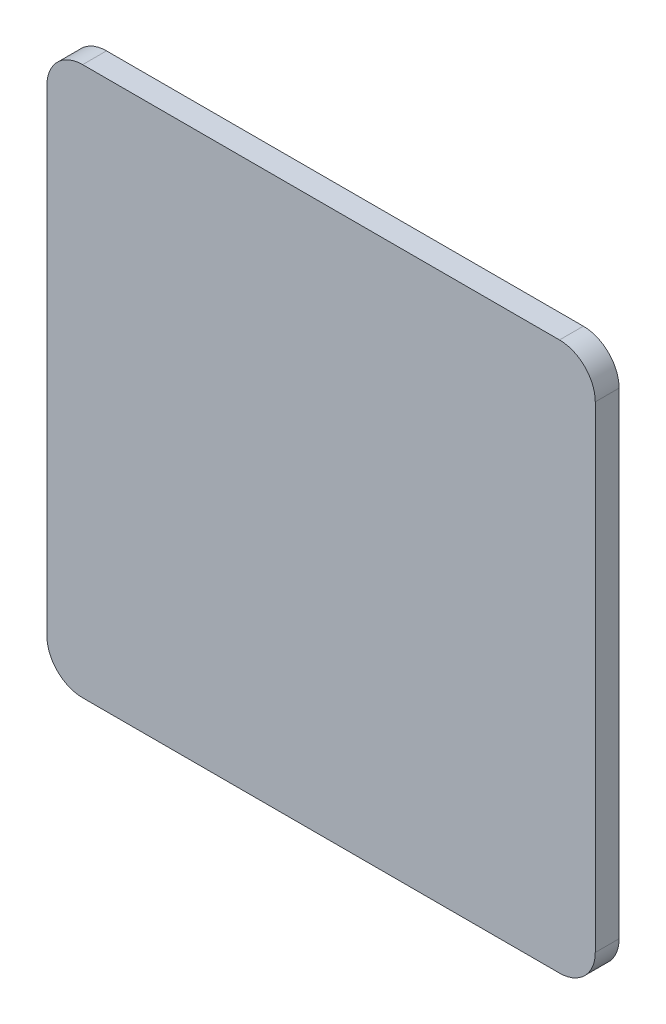
from build123d import *

# Parameters (mm, degrees)
SKETCH1_W           = 116.84
SKETCH1_H           = 116.84
BOSS_EXTRUDE1_DEPTH = 5.08
FILLET1_R           = 7.62


with BuildPart() as part:
    # Sketch1 → Boss-Extrude1 (new body)
    with BuildSketch(Plane.XY):
        Rectangle(SKETCH1_W, SKETCH1_H)
    extrude(amount=BOSS_EXTRUDE1_DEPTH)

    # Fillet1
    fillet1_edges = [part.edges().sort_by_distance(p)[0] for p in [
        (-58.42, -58.42, 2.54),
        (58.42, -58.42, 2.54),
        (58.42, 58.42, 2.54),
        (-58.42, 58.42, 2.54),
    ]]
    fillet(fillet1_edges, radius=FILLET1_R)


solid = part.part
